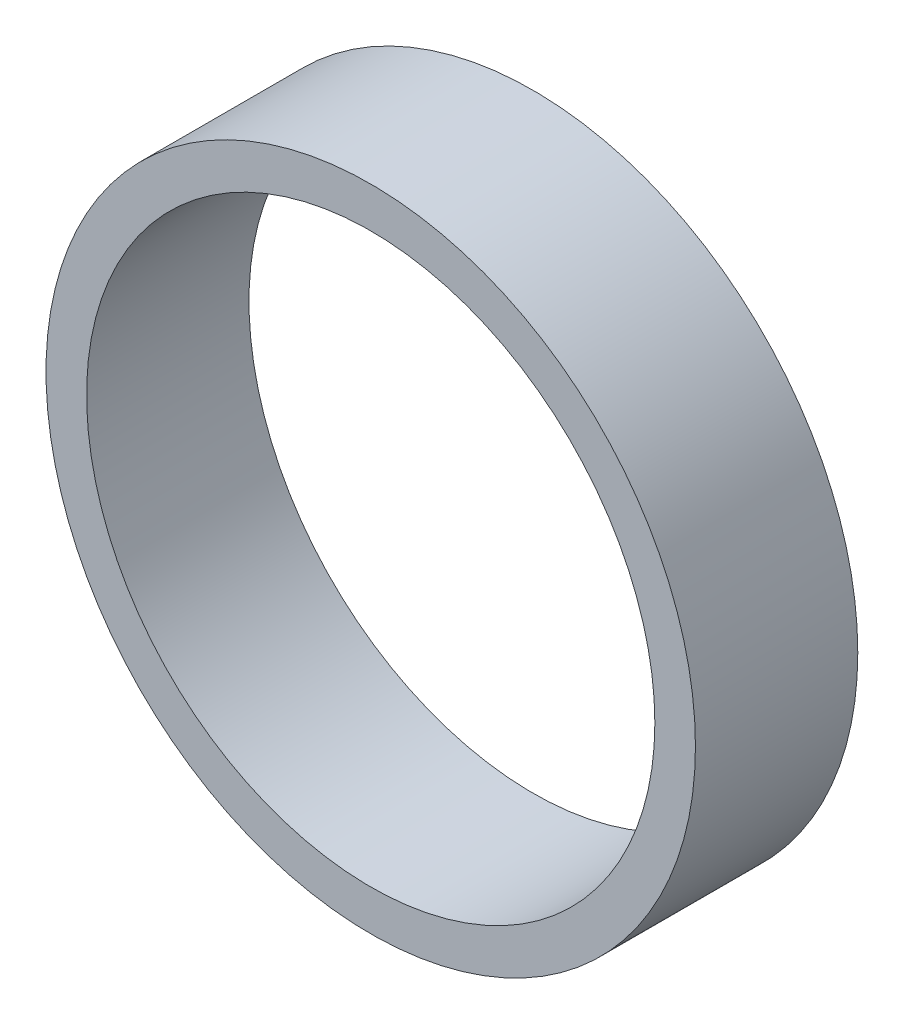
from build123d import *

# Parameters (mm, degrees)
SKETCH1_R           = 50.8
SKETCH1_R_2         = 44.45
BOSS_EXTRUDE1_DEPTH = 25.4


with BuildPart() as part:
    # Sketch1 → Boss-Extrude1 (new body)
    with BuildSketch(Plane.XY):
        Circle(SKETCH1_R)
        Circle(SKETCH1_R_2, mode=Mode.SUBTRACT)
    extrude(amount=BOSS_EXTRUDE1_DEPTH)


solid = part.part
